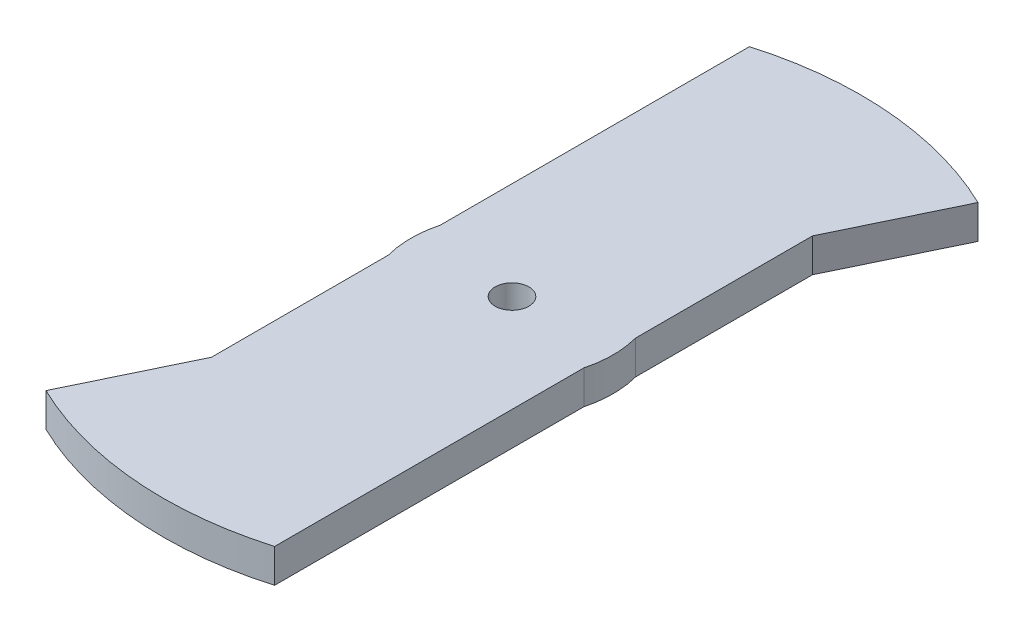
from build123d import *

# Parameters (mm, degrees)
SKETCH1_R           = 3.175
BOSS_EXTRUDE1_DEPTH = 6.35


with BuildPart() as part:
    # Sketch1 → Boss-Extrude1 (new body)
    with BuildSketch(Plane(origin=(0, 0, 0), x_dir=(1, 0, 0), z_dir=(0, 1, 0))):
        with BuildLine():
            ThreePointArc((28.559790419, 59.263278404), (5.43300968, 65.561270593), (-18.415, 63.156041445))
            Line((-18.415, 63.156041445), (-18.415, 4.87752755))
            ThreePointArc((-18.415, 4.87752755), (-19.05, 0), (-18.415, -4.87752755))
            Line((-18.415, -4.87752755), (-18.415, -38.212229705))
            Line((-18.415, -38.212229705), (-28.559790419, -59.263278404))
            ThreePointArc((-28.559790419, -59.263278404), (-5.43300968, -65.561270593), (18.415, -63.156041445))
            Line((18.415, -63.156041445), (18.415, -4.87752755))
            ThreePointArc((18.415, -4.87752755), (19.05, 0), (18.415, 4.87752755))
            Line((18.415, 4.87752755), (18.415, 38.212229705))
            Line((18.415, 38.212229705), (28.559790419, 59.263278404))
        make_face()
        Circle(SKETCH1_R, mode=Mode.SUBTRACT)
    extrude(amount=BOSS_EXTRUDE1_DEPTH)


solid = part.part
